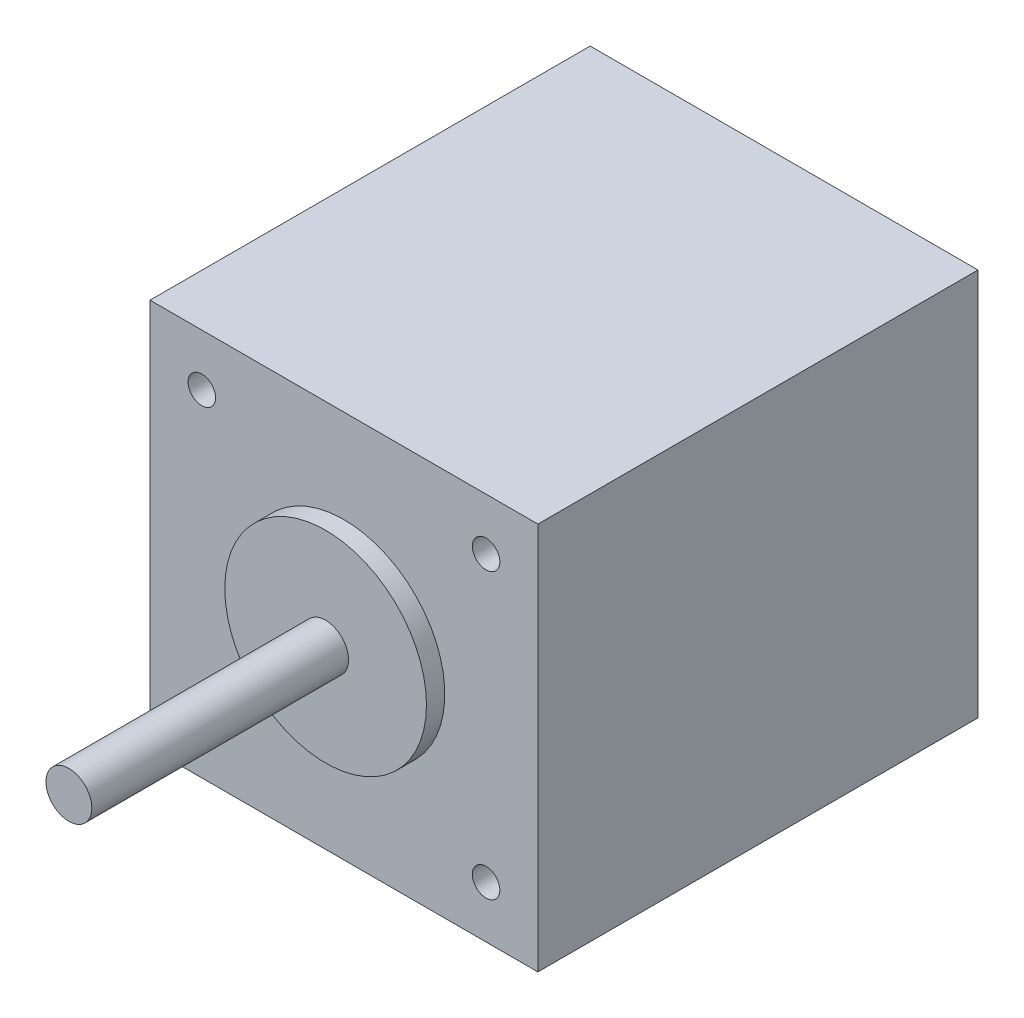
from build123d import *

# Parameters (mm, degrees)
SKETCH_1_W          = 42.3
SKETCH_1_H          = 42.3
EXTRUDE_1193_DEPTH  = 48
SKETCH_2_R          = 2.5
EXTRUDE_1248_DEPTH  = 78
SKETCH_3_R          = 11
EXTRUDE_1295_DEPTH  = 50
CUT_EXTRUDE_START   = 48
SKETCH_5_R          = 1.5
CUT_EXTRUDE_3_DEPTH = 4.5


with BuildPart() as part:
    # Эскиз1 → Extrude 1193 (new body)
    with BuildSketch(Plane.XY):
        Rectangle(SKETCH_1_W, SKETCH_1_H)
    extrude(amount=EXTRUDE_1193_DEPTH)

    # Эскиз2 → Extrude 1248 (add)
    with BuildSketch(Plane.XY):
        Circle(SKETCH_2_R)
    extrude(amount=EXTRUDE_1248_DEPTH)

    # Эскиз3 → Extrude 1295 (add)
    with BuildSketch(Plane.XY):
        Circle(SKETCH_3_R)
    extrude(amount=EXTRUDE_1295_DEPTH)

    # Эскиз5 → Крепеж_М3_ПРЕДВ (cut)
    with BuildSketch(Plane.XY.offset(CUT_EXTRUDE_START)):
        with Locations((-15.5, -15.5)):
            Circle(SKETCH_5_R)
        with Locations((-15.5, 15.5)):
            Circle(SKETCH_5_R)
        with Locations((15.5, -15.5)):
            Circle(SKETCH_5_R)
        with Locations((15.5, 15.5)):
            Circle(SKETCH_5_R)
    extrude(amount=-CUT_EXTRUDE_3_DEPTH, mode=Mode.SUBTRACT)


solid = part.part
